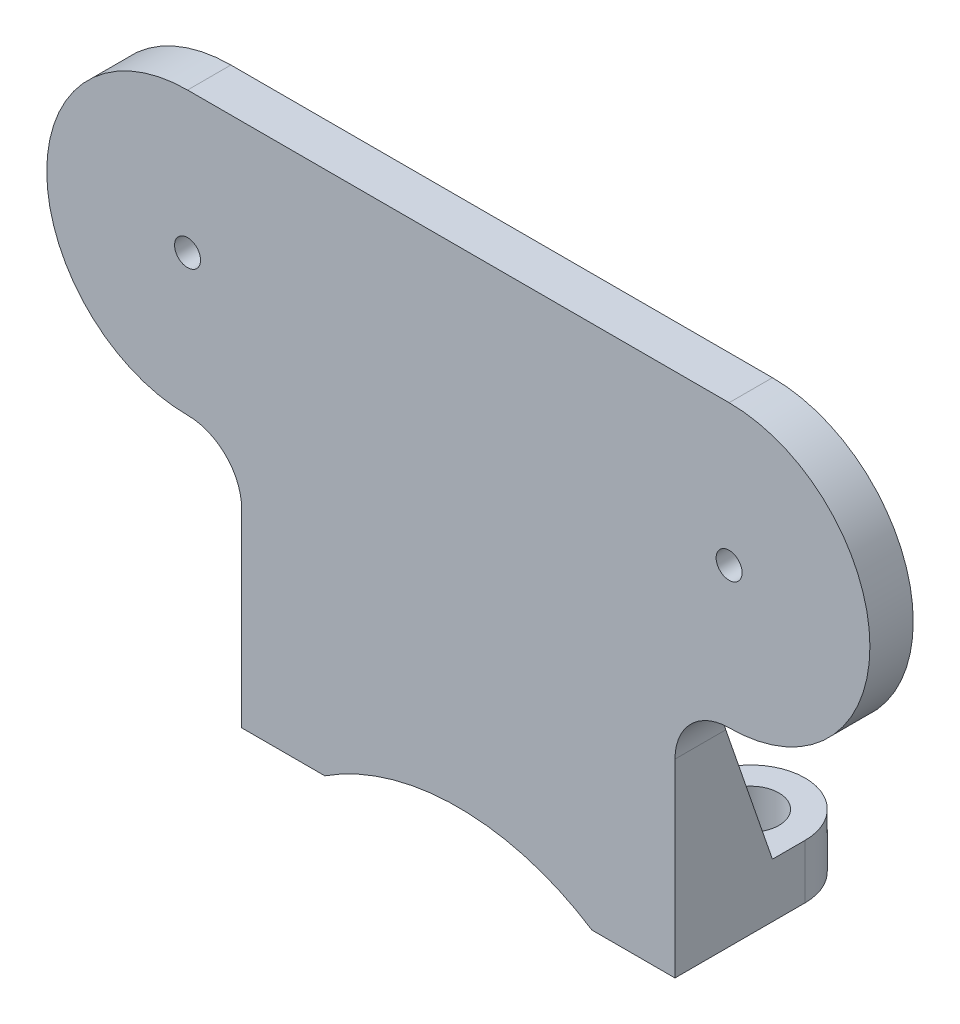
from build123d import *

# Parameters (mm, degrees)
EXTRUDE_1_OUTLINE_R             = 1.2
EXTRUDE_1_DEPTH                 = 4
SKETCH_2_R                      = 2.6
EXTRUDE_2_DEPTH                 = 5
CUT_EXTRUDE_1_REACH             = 55.603
CUT_EXTRUDE_1_DIRECTION_2_DEPTH = 54.602705156
EXTRUDE_4_DEPTH                 = 2
EXTRUDE_5_DEPTH                 = 2
FILLET_1_R                      = 3
FILLET_2_R                      = 5


# Read off the part's stored shape, not the designer's step: 凸台-拉伸1
with BuildPart() as part:
    # 凸台-拉伸1 outline → 凸台-拉伸1 (new body)
    with BuildSketch(Plane.XY):
        with BuildLine():
            ThreePointArc((-25, 13), (-38, 0), (-25, -13))
            Line((-25, -13), (-20, -13))
            Line((-20, -13), (-20, -35.5))
            Line((-20, -35.5), (20, -35.5))
            Line((20, -35.5), (20, -13))
            Line((20, -13), (25, -13))
            ThreePointArc((25, -13), (38, 0), (25, 13))
            Line((25, 13), (-25, 13))
        make_face()
        with Locations((-25, 0)):
            Circle(EXTRUDE_1_OUTLINE_R, mode=Mode.SUBTRACT)
        with Locations((25, 0)):
            Circle(EXTRUDE_1_OUTLINE_R, mode=Mode.SUBTRACT)
    extrude(amount=EXTRUDE_1_DEPTH)

    # 草图2 → 凸台-拉伸2 (add)
    # profile 1 of 2: a face of its own
    with BuildSketch(Plane.XZ.offset(35.5)):
        with BuildLine():
            Line((-20, -8), (-20, 0))
            Line((-20, 0), (-20, 4))
            Line((-20, 4), (-10, 4))
            Line((-10, 4), (-10, 0))
            Line((-10, 0), (-10, -8))
            ThreePointArc((-10, -8), (-15, -13), (-20, -8))
        make_face()
        with Locations(Location((-15, -8, 0), (0, 0, 270))):
            Circle(SKETCH_2_R, mode=Mode.SUBTRACT)
    # profile 2 of 2: a face of its own
    with BuildSketch(Plane.XZ.offset(35.5)):
        with BuildLine():
            Line((20, 0), (20, 4))
            Line((20, 4), (10, 4))
            Line((10, 4), (10, 0))
            Line((10, 0), (10, -8))
            ThreePointArc((10, -8), (15, -13), (20, -8))
            Line((20, -8), (20, 0))
        make_face()
        with Locations(Location((15, -8, 0), (0, 0, 270))):
            Circle(SKETCH_2_R, mode=Mode.SUBTRACT)
    extrude(amount=-EXTRUDE_2_DEPTH)

    # 草图3 → 切除-拉伸1 (cut, up to next)
    with BuildSketch(Plane(origin=(0, 0, 0), x_dir=(-1, 0, 0), z_dir=(0, 0, -1)), mode=Mode.PRIVATE) as cut_extrude_1_sk1:
        with BuildLine():
            Line((-12.329740468, -35.5), (12.329740468, -35.5))
            ThreePointArc((12.329740468, -35.5), (0, -31.85), (-12.329740468, -35.5))
        make_face()
    cut_extrude_1_tool1 = extrude(cut_extrude_1_sk1.sketch, amount=-CUT_EXTRUDE_1_REACH, mode=Mode.PRIVATE) & part.part
    add(cut_extrude_1_tool1.solids().sort_by_distance((0, -34.029422, 0))[0], mode=Mode.SUBTRACT)

    # 草图3 → 切除-拉伸1 direction 2 (cut)
    with BuildSketch(Plane(origin=(0, 0, 0), x_dir=(-1, 0, 0), z_dir=(0, 0, -1))):
        with BuildLine():
            Line((-12.329740468, -35.5), (12.329740468, -35.5))
            ThreePointArc((12.329740468, -35.5), (0, -31.85), (-12.329740468, -35.5))
        make_face()
    extrude(amount=CUT_EXTRUDE_1_DIRECTION_2_DEPTH, mode=Mode.SUBTRACT)

    # 草图5 → 凸台-拉伸4 (add)
    with BuildSketch(Plane(origin=(20, 0, 0), x_dir=(0, 0, -1), z_dir=(1, 0, 0))):
        Polygon((0, -16), (5, -30.5), (0, -30.5), align=None)
    extrude_4 = extrude(amount=-EXTRUDE_4_DEPTH)

    # 草图6 → 凸台-拉伸5 (add)
    with BuildSketch(Plane.ZY.offset(-10)):
        Polygon((-5, -30.5), (0, -16), (0, -30.5), align=None)
    extrude_5 = extrude(amount=-EXTRUDE_5_DEPTH)

    # 镜向1: 凸台-拉伸4, 凸台-拉伸5 across plane
    add(extrude_4.mirror(Plane(origin=(0, 0, 0), x_dir=(0, 0, 1), z_dir=(1, 0, 0))))
    add(extrude_5.mirror(Plane(origin=(0, 0, 0), x_dir=(0, 0, 1), z_dir=(1, 0, 0))))

    # 圆角1
    fillet_1_edges = [part.edges().sort_by_distance(p)[0] for p in [
        (15, -30.5, 0),
        (-15, -30.5, 0),
    ]]
    fillet(fillet_1_edges, radius=FILLET_1_R)

    # 圆角2
    fillet_2_edges = [part.edges().sort_by_distance(p)[0] for p in [
        (-20, -13, 2),
        (20, -13, 2),
    ]]
    fillet(fillet_2_edges, radius=FILLET_2_R - 0.0001)  # a hair under: the kernel refuses the full size


solid = part.part
